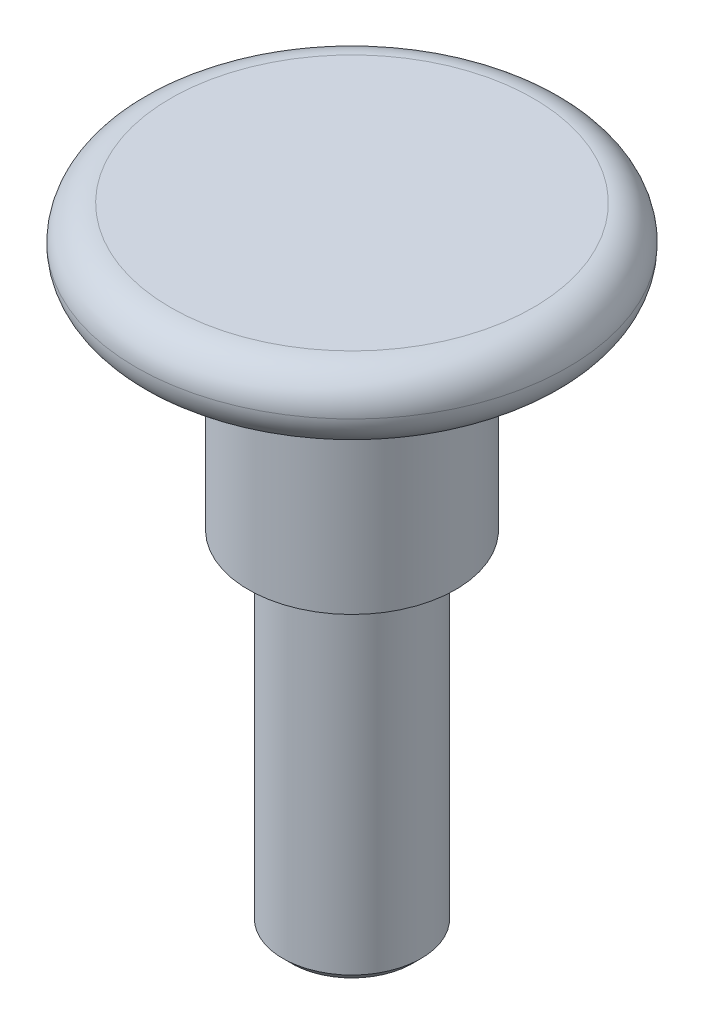
from build123d import *

# Parameters (mm, degrees)
FILETE1_R     = 2
CHANFRO1_SIZE = 0.5


with BuildPart() as part:
    # Esboço1 → Revolução1 (revolve)
    with BuildSketch(Plane.XY, mode=Mode.PRIVATE) as revolu_o1_sk:
        Polygon((0, 58.936157254), (12.5, 58.936157254), (12.5, 54.936157254), (6, 54.936157254), (6, 42.536157254), (4, 42.536157254), (4, 22.536157254), (1.75, 22.536157254), (1.75, 30.536157254), (0, 31.786157254), align=None)
    revolve(revolu_o1_sk.sketch.rotate(Axis((0, -51.524307863, 0), (0, 1, 0)), 90), axis=Axis((0, -51.524307863, 0), (0, 1, 0)))

    # Filete1
    filete1_edges = [part.edges().sort_by_distance(p)[0] for p in [
        (0, 54.936157254, 12.5),
        (0, 58.936157254, 12.5),
    ]]
    fillet(filete1_edges, radius=FILETE1_R - 0.0001)  # a hair under: the kernel refuses the full size

    # Chanfro1
    chanfro1_edges = [part.edges().sort_by_distance(p)[0] for p in [
        (0, 22.536157254, 4),
    ]]
    chamfer(chanfro1_edges, length=CHANFRO1_SIZE)


solid = part.part
